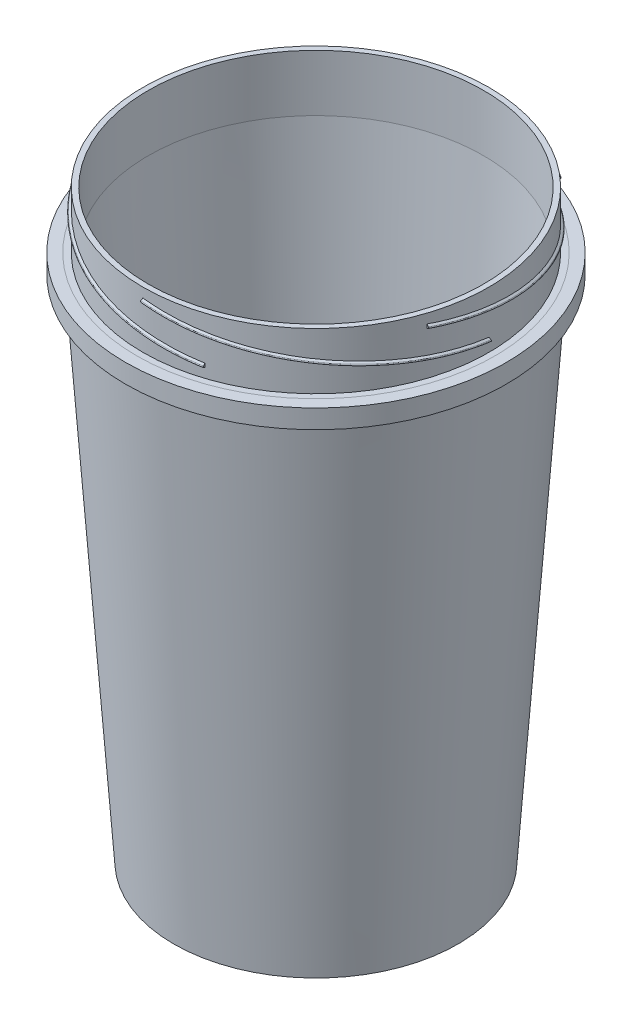
from build123d import *

# Parameters (mm, degrees)
SKETCH1_R                = 47.5
BOSS_EXTRUDE1_DEPTH      = 140
BOSS_EXTRUDE1_DRAFT      = -4
SHELL1_T                 = -3
SKETCH11_R               = 50.5
SKETCH11_R_2             = 47.5
BOSS_EXTRUDE2_DEPTH      = 5
SURFACE_EXTRUDE2_1_DEPTH = 15
THICKEN1_T2              = 1.4
SWEEP2_PITCH             = 36
CIRPATTERN1_COUNT        = 5


with BuildPart() as part:
    # Sketch1 → Boss-Extrude1 (with draft: the straight prism first)
    with BuildSketch(Plane(origin=(0, 0, 0), x_dir=(1, 0, 0), z_dir=(0, 1, 0))):
        Circle(SKETCH1_R)
    extrude(amount=-BOSS_EXTRUDE1_DEPTH)
    # Boss-Extrude1: the draft: its side faces are tilted about the plane it starts from
    boss_extrude1_sides = [part.faces().sort_by_distance(p)[0] for p in [
        (-47.5, -70, 0),
    ]]
    draft(boss_extrude1_sides, Plane(origin=(0, 0, 0), x_dir=(1, 0, 0), z_dir=(0, 1, 0)), BOSS_EXTRUDE1_DRAFT)

    # Shell1
    shell1_openings = [part.faces().sort_by_distance(p)[0] for p in [
        (0, 0, 0),
    ]]
    offset(amount=SHELL1_T, openings=shell1_openings, kind=Kind.INTERSECTION)

    # Surface-Extrude2: a surface, the sketch's curves swept straight by 15 mm
    with BuildLine(Plane(origin=(0, 0, 0), x_dir=(1, 0, 0), z_dir=(0, 1, 0)), mode=Mode.PRIVATE) as surface_extrude2_1_path:
        CenterArc((0, 0), 44.492674306, 0, 360)
    surface_extrude2_1 = Shell.extrude(surface_extrude2_1_path.wire(), (0 * SURFACE_EXTRUDE2_1_DEPTH, 1 * SURFACE_EXTRUDE2_1_DEPTH, 0 * SURFACE_EXTRUDE2_1_DEPTH))
    add(Solid.thicken(surface_extrude2_1, -THICKEN1_T2))

    # Sweep2: the profile of Sketch21 profile screwed along a left-hand helix of 0.25 turns, 24 arcs to a turn; built about Z, then put on its axis
    sweep2_z = Axis((0, 0, 0), (0, 0, 1))
    sweep2_corners = [(45.892374306, 0, -0.500173205), (45.892374306, 0, 0.500173205), (46.45869971, 0, 0.173205081), (46.55869971, 0, 0), (46.45869971, 0, -0.173205081)]
    with BuildLine(mode=Mode.PRIVATE) as sweep2_profile:
        Line(sweep2_corners[0], sweep2_corners[1])
        Line(sweep2_corners[1], sweep2_corners[2])
        Line(sweep2_corners[4], sweep2_corners[0])
        ThreePointArc((46.45869971, 0, 0.173205081), (46.53190479, 0, 0.1), (46.55869971, 0, 0))
        ThreePointArc((46.55869971, 0, 0), (46.53190479, 0, -0.1), (46.45869971, 0, -0.173205081))
    sweep2_cap = Face(sweep2_profile.wire())
    sweep2_arcs = [((46.45869971, 0, 0.173205081), (46.55869971, 0, 0.115470054), (46.55869971, 0, 0), (1, 0.8660254037844394, 1)), ((46.55869971, 0, 0), (46.55869971, 0, -0.115470054), (46.45869971, 0, -0.173205081), (1, 0.8660254037844394, 1))]  # start, shoulder, end, weights
    sweep2_turn_angles = [0, -7.5, -15, -22.5, -30, -37.5, -45, -52.5, -60, -67.5, -75, -82.5, -90]
    sweep2_turn_weights = [1, 0.9914448613738104, 1, 0.9914448613738104, 1, 0.9914448613738104, 1, 0.9914448613738104, 1, 0.9914448613738104, 1, 0.9914448613738102, 1]
    sweep2_turn_rails = [Edge.make_bspline([Vector(p[0], p[1], 0).rotate(sweep2_z, sweep2_turn_angles[k]) / sweep2_turn_weights[k] + Vector(0, 0, p[2] + -SWEEP2_PITCH * sweep2_turn_angles[k] / 360) for k in range(13)], [0, 0, 0, 1, 1, 2, 2, 3, 3, 4, 4, 5, 5, 6, 6, 6], 2, sweep2_turn_weights) for p in sweep2_corners]
    sweep2_turn_sides = [*[Face.make_surface_from_curves(sweep2_turn_rails[p[0]], sweep2_turn_rails[p[1]]) for p in [(0, 1), (1, 2), (4, 0)]], *[Face.make_bezier_surface([[Vector(p[j][0], p[j][1], 0).rotate(sweep2_z, sweep2_turn_angles[2 * i + k]) / sweep2_turn_weights[2 * i + k] + Vector(0, 0, p[j][2] + -SWEEP2_PITCH * sweep2_turn_angles[2 * i + k] / 360) for k in range(3)] for j in range(3)], [[p[3][j] * sweep2_turn_weights[2 * i + k] for k in range(3)] for j in range(3)]) for p in sweep2_arcs for i in range(6)]]
    sweep2 = Plane(origin=(0, 3, 0), x_dir=(1, 0, 0), z_dir=(0, 1, 0)) * Solid(Shell([*sweep2_turn_sides, sweep2_cap, sweep2_cap.rotate(sweep2_z, -90).moved(Location((0, 0, -SWEEP2_PITCH * -90 / 360)))]))
    add(sweep2)

    # CirPattern1: Sweep2 ×5 about axis
    cirpattern1_axis = Axis((0, 0, 0), (0, 1, 0))
    for i in range(1, CIRPATTERN1_COUNT):
        add(sweep2.rotate(cirpattern1_axis, i * 360 / CIRPATTERN1_COUNT))


with BuildPart() as body_2:
    # Sketch11 → Boss-Extrude2 (new body)
    with BuildSketch(Plane(origin=(0, 0, 0), x_dir=(1, 0, 0), z_dir=(0, 1, 0))):
        with Locations(Location((0, 0, 0), (0, 0, 270))):
            Circle(SKETCH11_R)
        with Locations(Location((0, 0, 0), (0, 0, 270))):
            Circle(SKETCH11_R_2, mode=Mode.SUBTRACT)
    extrude(amount=-BOSS_EXTRUDE2_DEPTH)


solid = Compound([part.part, body_2.part])
